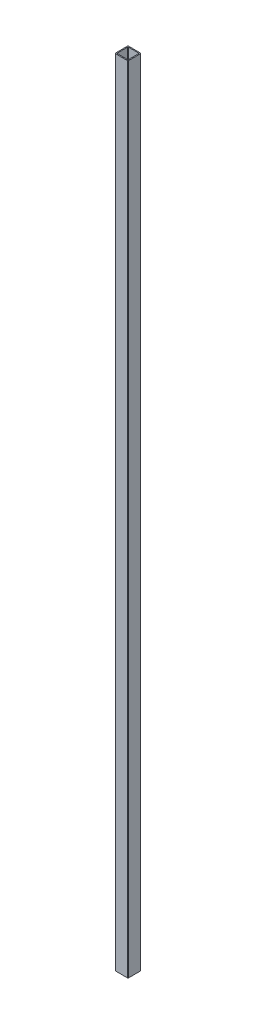
from build123d import *

# Parameters (mm, degrees)
BOSS_EXTRUDE1_DEPTH = 1210


with BuildPart() as part:
    # Sketch1 → Boss-Extrude1 (new body)
    with BuildSketch(Plane(origin=(0, 0, 0), x_dir=(1, 0, 0), z_dir=(0, 1, 0))):
        with BuildLine():
            Line((-9, -10), (9, -10))
            ThreePointArc((9, -10), (9.707106781, -9.707106781), (10, -9))
            Line((10, -9), (10, 9))
            ThreePointArc((10, 9), (9.707106781, 9.707106781), (9, 10))
            Line((9, 10), (-9, 10))
            ThreePointArc((-9, 10), (-9.707106781, 9.707106781), (-10, 9))
            Line((-10, 9), (-10, -9))
            ThreePointArc((-10, -9), (-9.707106781, -9.707106781), (-9, -10))
        make_face()
        with BuildLine():
            Line((-7.5, -8.5), (7.5, -8.5))
            ThreePointArc((7.5, -8.5), (8.207106781, -8.207106781), (8.5, -7.5))
            Line((8.5, -7.5), (8.5, 7.5))
            ThreePointArc((8.5, 7.5), (8.207106781, 8.207106781), (7.5, 8.5))
            Line((7.5, 8.5), (-7.5, 8.5))
            ThreePointArc((-7.5, 8.5), (-8.207106781, 8.207106781), (-8.5, 7.5))
            Line((-8.5, 7.5), (-8.5, -7.5))
            ThreePointArc((-8.5, -7.5), (-8.207106781, -8.207106781), (-7.5, -8.5))
        make_face(mode=Mode.SUBTRACT)
    extrude(amount=BOSS_EXTRUDE1_DEPTH)


solid = part.part
